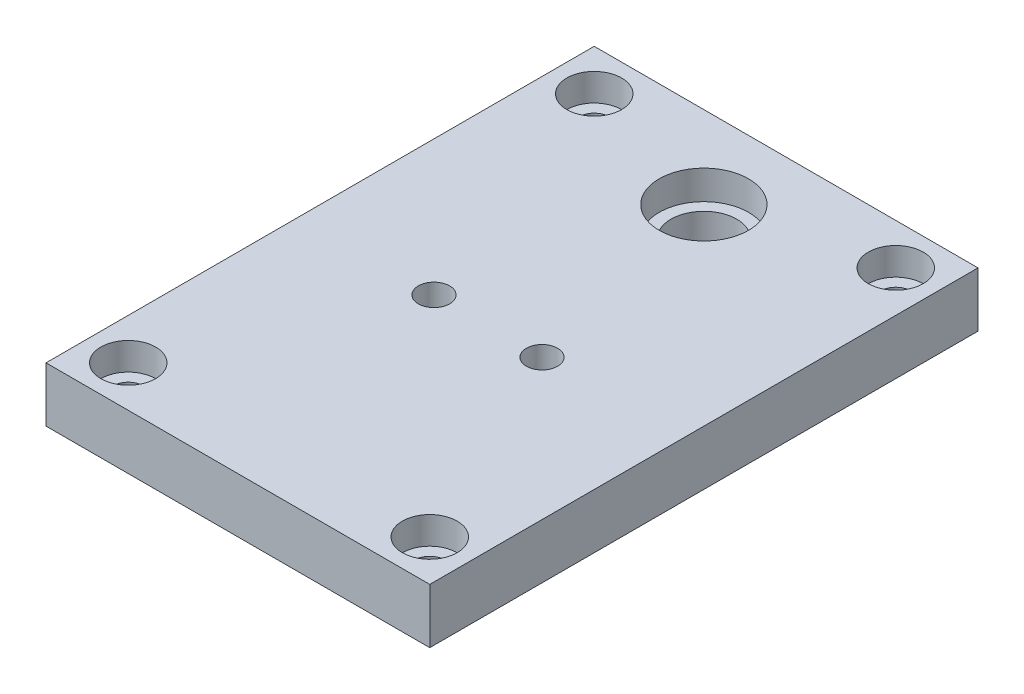
from build123d import *

# Parameters (mm, degrees)
SKETCH1_W                      = 70
SKETCH1_H                      = 100
BOSS_EXTRUDE1_DEPTH            = 10
CBORE_FOR_M5_SHCS1_D           = 5.5
CBORE_FOR_M5_SHCS1_CBORE_D     = 10
CBORE_FOR_M5_SHCS1_CBORE_DEPTH = 5
F_1_0MM_DOWEL_HOLE1_D          = 16.3
F_1_0MM_DOWEL_HOLE1_DEPTH      = 5.3
F_1_0MM_DOWEL_HOLE2_D          = 5.7
F_1_0MM_DOWEL_HOLE3_D          = 12


with BuildPart() as part:
    # Sketch1 → Boss-Extrude1 (new body)
    with BuildSketch(Plane(origin=(0, 0, 0), x_dir=(1, 0, 0), z_dir=(0, 1, 0))):
        Rectangle(SKETCH1_W, SKETCH1_H)
    extrude(amount=BOSS_EXTRUDE1_DEPTH)

    # CBORE for M5 SHCS1 (through all)
    with Locations(Plane(origin=(0, 10, 0), x_dir=(1, 0, 0), z_dir=(0, 1, 0))):
        with Locations((-27.5, -42.5), (-27.5, 42.5), (27.5, 42.5), (27.5, -42.5)):
            CounterBoreHole(CBORE_FOR_M5_SHCS1_D / 2, CBORE_FOR_M5_SHCS1_CBORE_D / 2, CBORE_FOR_M5_SHCS1_CBORE_DEPTH)

    # Ø1.0mm Dowel Hole1
    with Locations(Plane(origin=(0, 10, 0), x_dir=(1, 0, 0), z_dir=(0, 1, 0))):
        with Locations((0, 35)):
            Hole(F_1_0MM_DOWEL_HOLE1_D / 2, depth=F_1_0MM_DOWEL_HOLE1_DEPTH)

    # Ø1.0mm Dowel Hole2 (through all)
    with Locations(Plane(origin=(0, 10, 0), x_dir=(1, 0, 0), z_dir=(0, 1, 0))):
        with Locations((-10.351817541, -3.882931749), (9.352839391, -3.882931749)):
            Hole(F_1_0MM_DOWEL_HOLE2_D / 2)

    # Ø1.0mm Dowel Hole3 (through all)
    with Locations(Plane(origin=(0, 4.7, 0), x_dir=(1, 0, 0), z_dir=(0, 1, 0))):
        with Locations((0, 35)):
            Hole(F_1_0MM_DOWEL_HOLE3_D / 2)


solid = part.part
